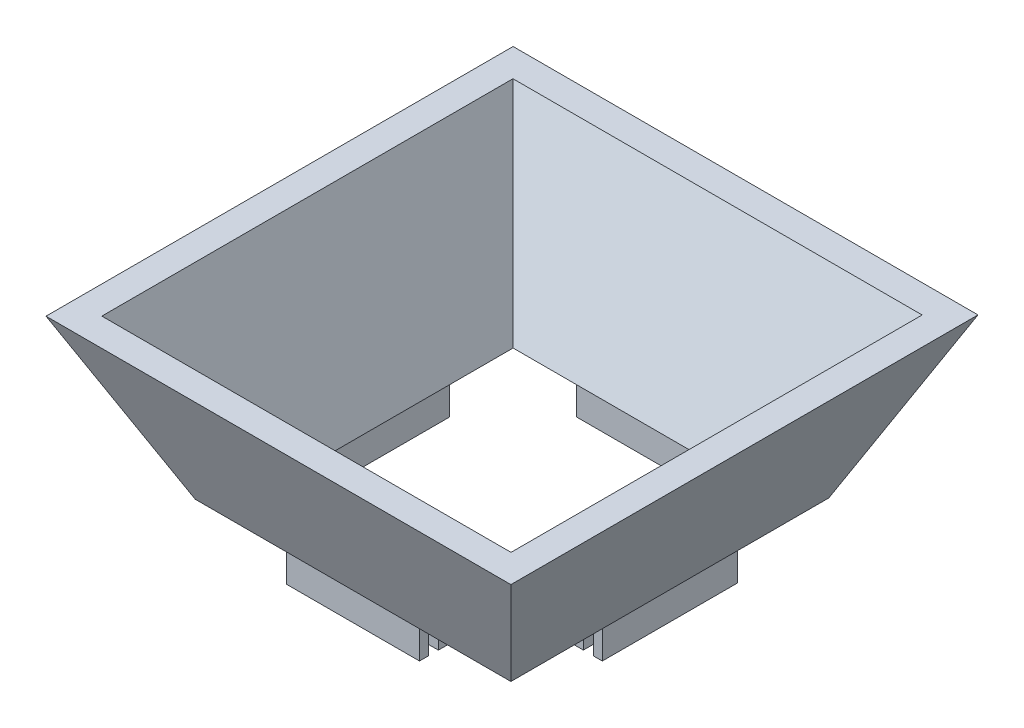
from build123d import *

# Parameters (mm, degrees)
SKETCH1_W             = 189.14
SKETCH1_H             = 190.74
SKETCH1_W_2           = 176.82
SKETCH1_H_2           = 178.315780904
BOSS_EXTRUDE2_DEPTH   = 19.05
SKETCH1_W_3           = 214.92
SKETCH1_H_3           = 216.415780904
SKETCH1_W_4           = 202.6
SKETCH1_H_4           = 204.2
BOSS_EXTRUDE2_2_DEPTH = 19.05
SKETCH7_W             = 226.06
SKETCH7_H             = 226.06
CUT_EXTRUDE1_DEPTH    = 255


with BuildPart() as part:
    # Sketch1 → Boss-Extrude2 (new body)
    with BuildSketch(Plane(origin=(0, 0, 0), x_dir=(1, 0, 0), z_dir=(0, 1, 0))):
        Rectangle(SKETCH1_W, SKETCH1_H)
        Rectangle(SKETCH1_W_2, SKETCH1_H_2, mode=Mode.SUBTRACT)
    extrude(amount=BOSS_EXTRUDE2_DEPTH)



with BuildPart() as body_2:
    # Sketch1 → Boss-Extrude2 2 (new body)
    with BuildSketch(Plane(origin=(0, 0, 0), x_dir=(1, 0, 0), z_dir=(0, 1, 0))):
        Rectangle(SKETCH1_W_3, SKETCH1_H_3)
        Rectangle(SKETCH1_W_4, SKETCH1_H_4, mode=Mode.SUBTRACT)
    extrude(amount=BOSS_EXTRUDE2_2_DEPTH)


with BuildPart() as part_1:
    add(part.part)

    add(body_2.part)  # Loft1 merges body 2
    # Sketch2 → Loft1 section 0
    with BuildSketch(Plane(origin=(0, 127, 0), x_dir=(1, 0, 0), z_dir=(0, 1, 0))):
        with BuildLine():
            Line((-158.26, -159.007890452), (158.26, -159.007890452))
            Line((158.26, -159.007890452), (158.26, 159.007890452))
            Line((158.26, 159.007890452), (-158.26, 159.007890452))
            Line((-158.26, 159.007890452), (-158.26, -159.007890452))
        make_face()
    # Sketch4 → Loft1 section 1
    with BuildSketch(Plane(origin=(0, 19.05, 0), x_dir=(1, 0, 0), z_dir=(0, 1, 0))):
        with BuildLine():
            Line((-107.46, 108.207890452), (107.46, 108.207890452))
            Line((107.46, 108.207890452), (107.46, -108.207890452))
            Line((107.46, -108.207890452), (-107.46, -108.207890452))
            Line((-107.46, -108.207890452), (-107.46, 108.207890452))
        make_face()
    loft()

    # Sketch6 → Cut-Loft1 section 0
    with BuildSketch(Plane(origin=(0, 127, 0), x_dir=(1, 0, 0), z_dir=(0, 1, 0))):
        with BuildLine():
            Line((-139.299601296, -139.957890452), (139.299601296, -139.957890452))
            Line((139.299601296, -139.957890452), (139.299601296, 139.957890452))
            Line((139.299601296, 139.957890452), (-139.299601296, 139.957890452))
            Line((-139.299601296, 139.957890452), (-139.299601296, -139.957890452))
        make_face()
    # Sketch5 → Cut-Loft1 section 1
    with BuildSketch(Plane(origin=(0, 19.05, 0), x_dir=(1, 0, 0), z_dir=(0, 1, 0))):
        with BuildLine():
            Line((-88.41, 89.157890452), (88.41, 89.157890452))
            Line((88.41, 89.157890452), (88.41, -89.157890452))
            Line((88.41, -89.157890452), (-88.41, -89.157890452))
            Line((-88.41, -89.157890452), (-88.41, 89.157890452))
        make_face()
    loft(mode=Mode.SUBTRACT)

    # Sketch7 → Cut-Extrude1 (cut)
    with BuildSketch(Plane.XZ.offset(-19.05)):
        with Locations((-158.26, 159.007890452)):
            Rectangle(SKETCH7_W, SKETCH7_H)
        with Locations((158.26, 159.007890452)):
            Rectangle(SKETCH7_W, SKETCH7_H)
        with Locations((-158.26, -159.007890452)):
            Rectangle(SKETCH7_W, SKETCH7_H)
        with Locations((158.26, -159.007890452)):
            Rectangle(SKETCH7_W, SKETCH7_H)
    extrude(amount=CUT_EXTRUDE1_DEPTH, mode=Mode.SUBTRACT)


solid = part_1.part
